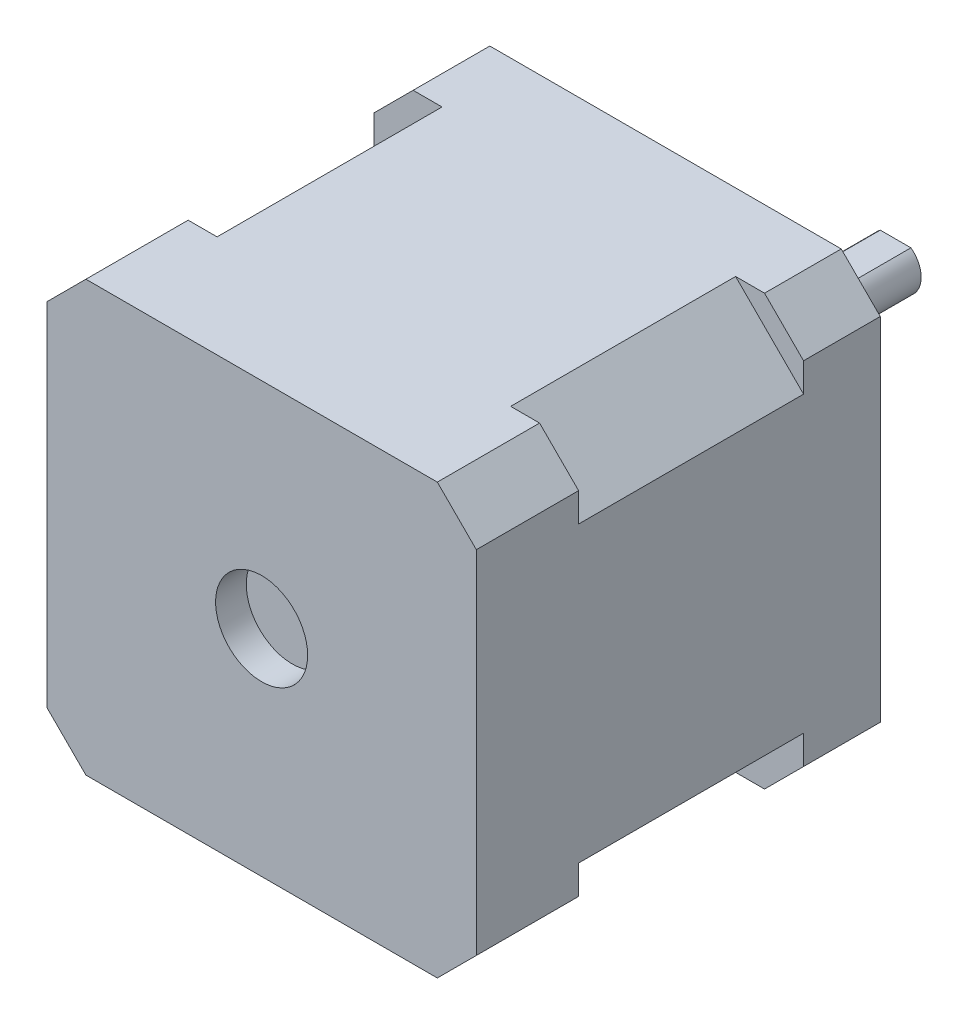
from build123d import *

# Parameters (mm, degrees)
EXTRUDE_1_DEPTH     = 39.5
SKETCH_2_R          = 11
EXTRUDE_2_DEPTH     = 2
SKETCH_3_R          = 2.5
EXTRUDE_3_DEPTH     = 20.5
SKETCH_4_R          = 1.5
CUT_EXTRUDE_1_DEPTH = 5
CUT_EXTRUDE_START   = -18
CUT_EXTRUDE_2_DEPTH = 18
SKETCH_6_R          = 4.5
CUT_EXTRUDE_3_DEPTH = 3
CUT_EXTRUDE_START_2 = -3
SKETCH_7_R          = 4.5
SKETCH_7_R_2        = 2.5
CUT_EXTRUDE_4_DEPTH = 3
SKETCH_8_W          = 61.801157568
SKETCH_8_H          = 60.217907666
CUT_EXTRUDE_5_DEPTH = 22


with BuildPart() as part:
    # 草图1 → 凸台-拉伸1 (new body)
    with BuildSketch(Plane.XY):
        Polygon((-17.183766184, 21), (17.183766184, 21), (21, 17.183766184), (21, -17.183766184), (17.183766184, -21), (-17.183766184, -21), (-21, -17.183766184), (-21, 17.183766184), align=None)
    extrude(amount=EXTRUDE_1_DEPTH)

    # 草图2 → 凸台-拉伸2 (add)
    with BuildSketch(Plane(origin=(0, 0, 0), x_dir=(-1, 0, 0), z_dir=(0, 0, -1))):
        Circle(SKETCH_2_R)
    extrude(amount=EXTRUDE_2_DEPTH)

    # 草图3 → 凸台-拉伸3 (add)
    with BuildSketch(Plane(origin=(0, 0, -2), x_dir=(-1, 0, 0), z_dir=(0, 0, -1))):
        Circle(SKETCH_3_R)
    extrude(amount=EXTRUDE_3_DEPTH)

    # 草图4 → 切除-拉伸1 (cut)
    with BuildSketch(Plane(origin=(0, 0, 0), x_dir=(-1, 0, 0), z_dir=(0, 0, -1))):
        with Locations((-15.5, -15.5)):
            Circle(SKETCH_4_R)
        with Locations((-15.5, 15.5)):
            Circle(SKETCH_4_R)
        with Locations((15.5, 15.5)):
            Circle(SKETCH_4_R)
        with Locations((15.5, -15.5)):
            Circle(SKETCH_4_R)
    extrude(amount=-CUT_EXTRUDE_1_DEPTH, mode=Mode.SUBTRACT)

    # 草图5 → 切除-拉伸2 (cut)
    with BuildSketch(Plane(origin=(0, 0, -22.5), x_dir=(-1, 0, 0), z_dir=(0, 0, -1)).offset(CUT_EXTRUDE_START)):
        with BuildLine():
            Line((1.5, 2), (-1.5, 2))
            ThreePointArc((-1.5, 2), (0, 2.5), (1.5, 2))
        make_face()
    extrude(amount=CUT_EXTRUDE_2_DEPTH, mode=Mode.SUBTRACT)

    # 草图6 → 切除-拉伸3 (cut)
    with BuildSketch(Plane.XY.offset(39.5)):
        Circle(SKETCH_6_R)
    extrude(amount=-CUT_EXTRUDE_3_DEPTH, mode=Mode.SUBTRACT)

    # 草图7 → 切除-拉伸4 (cut)
    with BuildSketch(Plane(origin=(0, 0, -2), x_dir=(-1, 0, 0), z_dir=(0, 0, -1)).offset(CUT_EXTRUDE_START_2)):
        Circle(SKETCH_7_R)
        Circle(SKETCH_7_R_2, mode=Mode.SUBTRACT)
    extrude(amount=CUT_EXTRUDE_4_DEPTH, mode=Mode.SUBTRACT)

    # 草图8 → 切除-拉伸5 (cut)
    with BuildSketch(Plane.XY.offset(29.5)):
        Rectangle(SKETCH_8_W, SKETCH_8_H)
        Polygon((21, -14.355339059), (21, 14.355339059), (14.355339059, 21), (-14.355339059, 21), (-21, 14.355339059), (-21, -14.355339059), (-14.355339059, -21), (14.355339059, -21), align=None, mode=Mode.SUBTRACT)
    extrude(amount=-CUT_EXTRUDE_5_DEPTH, mode=Mode.SUBTRACT)


solid = part.part
